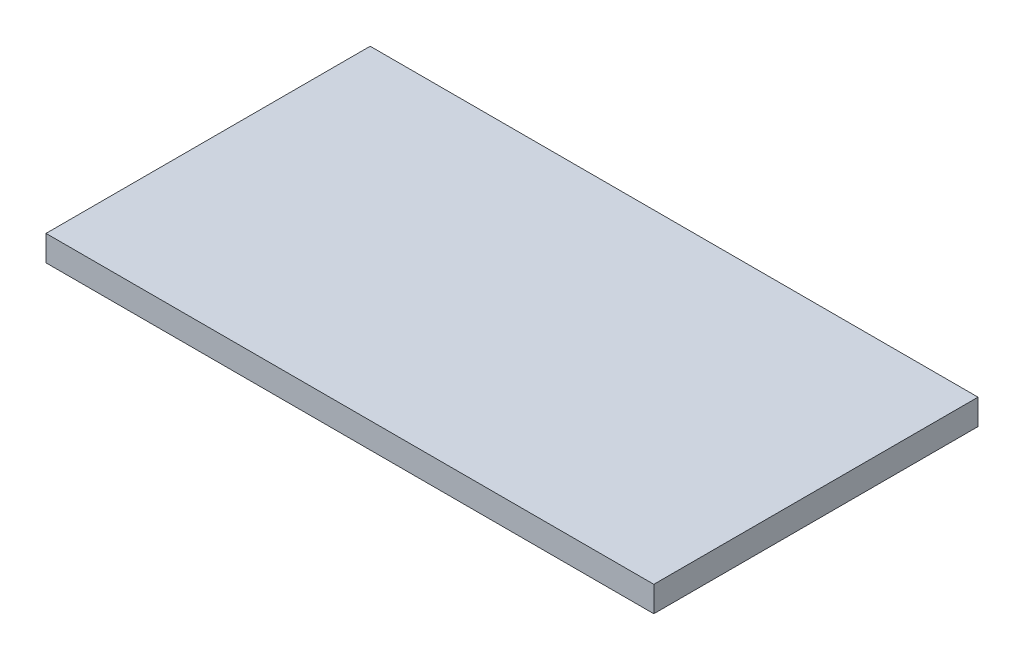
from build123d import *

# Parameters (mm, degrees)
SKETCH1_W           = 38.1
SKETCH1_H           = 20.32
BOSS_EXTRUDE1_DEPTH = 0.8


with BuildPart() as part:
    # Sketch1 → Boss-Extrude1 (new, symmetric)
    with BuildSketch(Plane(origin=(0, 0, 0), x_dir=(1, 0, 0), z_dir=(0, 1, 0))):
        Rectangle(SKETCH1_W, SKETCH1_H)
    extrude(amount=BOSS_EXTRUDE1_DEPTH, both=True)


solid = part.part
